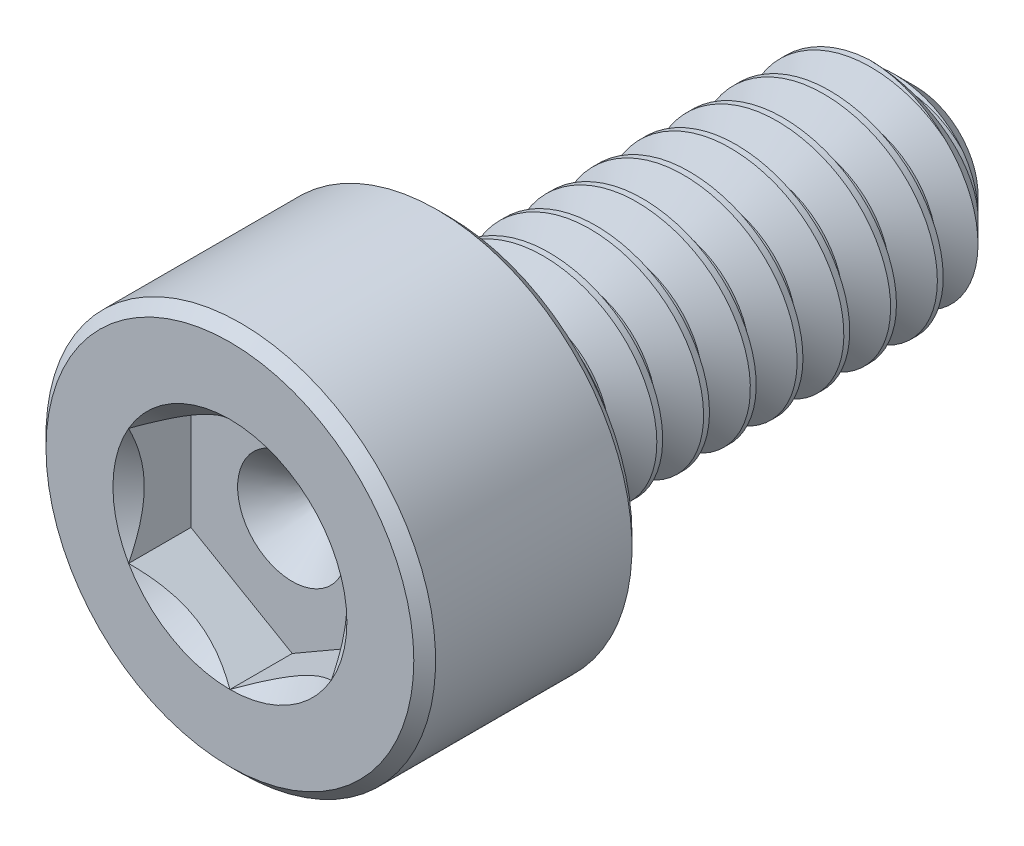
from build123d import *

# Parameters (mm, degrees)
CUT_EXTRUDE1_DEPTH = 0.4
SKETCH4_R          = 0.75055535
CUT_EXTRUDE2_DEPTH = 0.7
CUT_EXTRUDE2_DRAFT = -45
CUT_SWEEP1_PITCH   = 0.3


# Read off the part's stored shape, not the designer's step: Split1
with BuildPart() as part:
    # Sketch2 → Revolve1 (revolve)
    with BuildSketch(Plane(origin=(0, 0, 0), x_dir=(0, 0, -1), z_dir=(1, 0, 0))):
        Polygon((-2.2, 0), (-2.2, 1.18), (-2.13, 1.25), (-0.87, 1.25), (-0.8, 1.18), (-0.8, 0.7), (1.9, 0.7), (2.2, 0.4), (2.2, 0), align=None)
    revolve(axis=Axis((0, 0, -2.2), (0, 0, 1)))

    # Sketch3 → Cut-Extrude1 (cut)
    with BuildSketch(Plane.XY.offset(2.2)):
        Polygon((0.65, -0.375277675), (0.65, 0.375277675), (0, 0.75055535), (-0.65, 0.375277675), (-0.65, -0.375277675), (0, -0.75055535), align=None)
    extrude(amount=-CUT_EXTRUDE1_DEPTH, mode=Mode.SUBTRACT)


with BuildPart() as cut_extrude2_tool:
    # Sketch4 → Cut-Extrude2 (with draft: the straight prism first)
    with BuildSketch(Plane.XY.offset(2.2)):
        Circle(SKETCH4_R)
    extrude(amount=-CUT_EXTRUDE2_DEPTH)
    # Cut-Extrude2: the draft: its side faces are tilted about the plane it starts from
    cut_extrude2_sides = [cut_extrude2_tool.faces().sort_by_distance(p)[0] for p in [
        (-0.75055535, 0, 1.85),
    ]]
    draft(cut_extrude2_sides, Plane.XY.offset(2.2), CUT_EXTRUDE2_DRAFT)


with BuildPart() as part_1:
    add(part.part)

    # Cut-Extrude2: cut by cut_extrude2_tool
    add(cut_extrude2_tool.part, mode=Mode.SUBTRACT)


with BuildPart() as body_2:
    # Split1: the piece on the far side of the plane
    add(part_1.part)
    split(bisect_by=Plane.XY.offset(0.8), keep=Keep.BOTTOM)

    # Cut-Sweep1: the profile of Sketch7 screwed along a right-hand helix of 11.15 turns, 6 arcs to a turn; built about Z, then put on its axis
    cut_sweep1_z = Axis((0, 0, 0), (0, 0, 1))
    cut_sweep1_corners = [(0.716237976, 0, 0.009375), (0.716237976, 0, -0.271875), (0.505144284, 0, -0.15), (0.505144284, 0, -0.1125)]
    with BuildLine(mode=Mode.PRIVATE) as cut_sweep1_profile:
        Line(cut_sweep1_corners[0], cut_sweep1_corners[1])
        Line(cut_sweep1_corners[1], cut_sweep1_corners[2])
        Line(cut_sweep1_corners[2], cut_sweep1_corners[3])
        Line(cut_sweep1_corners[3], cut_sweep1_corners[0])
    cut_sweep1_cap = Face(cut_sweep1_profile.wire())
    cut_sweep1_turn_angles = [0, 30, 60, 90, 120, 150, 180, 210, 240, 270, 300, 330, 360]
    cut_sweep1_turn_weights = [1, 0.8660254037844387, 1, 0.8660254037844387, 1, 0.8660254037844387, 1, 0.8660254037844387, 1, 0.8660254037844387, 1, 0.8660254037844387, 1]
    cut_sweep1_turn_rails = [Edge.make_bspline([Vector(p[0], p[1], 0).rotate(cut_sweep1_z, cut_sweep1_turn_angles[k]) / cut_sweep1_turn_weights[k] + Vector(0, 0, p[2] + CUT_SWEEP1_PITCH * cut_sweep1_turn_angles[k] / 360) for k in range(13)], [0, 0, 0, 1, 1, 2, 2, 3, 3, 4, 4, 5, 5, 6, 6, 6], 2, cut_sweep1_turn_weights) for p in cut_sweep1_corners]
    cut_sweep1_turn_sides = [Face.make_surface_from_curves(cut_sweep1_turn_rails[p[0]], cut_sweep1_turn_rails[p[1]]) for p in [(0, 1), (1, 2), (2, 3), (3, 0)]]
    cut_sweep1_last_angles = [3960, 3987, 4014]
    cut_sweep1_last_weights = [1, 0.8910065241884219, 1]
    cut_sweep1_last_rails = [Edge.make_bspline([Vector(p[0], p[1], 0).rotate(cut_sweep1_z, cut_sweep1_last_angles[k]) / cut_sweep1_last_weights[k] + Vector(0, 0, p[2] + CUT_SWEEP1_PITCH * cut_sweep1_last_angles[k] / 360) for k in range(3)], [0, 0, 0, 1, 1, 1], 2, cut_sweep1_last_weights) for p in cut_sweep1_corners]
    cut_sweep1_last_sides = [Face.make_surface_from_curves(cut_sweep1_last_rails[p[0]], cut_sweep1_last_rails[p[1]]) for p in [(0, 1), (1, 2), (2, 3), (3, 0)]]
    cut_sweep1 = Plane(origin=(0, 0, -2.2), x_dir=(0, 1, 0), z_dir=(0, 0, 1)) * Solid(Shell([*[p.moved(Location((0, 0, CUT_SWEEP1_PITCH * i))) for i in range(11) for p in cut_sweep1_turn_sides], *cut_sweep1_last_sides, cut_sweep1_cap, cut_sweep1_cap.rotate(cut_sweep1_z, 4014).moved(Location((0, 0, CUT_SWEEP1_PITCH * 4014 / 360)))]))
    add(cut_sweep1, mode=Mode.SUBTRACT)


with BuildPart() as part_2:
    add(part_1.part)

    # Split1
    split(bisect_by=Plane.XY.offset(0.8), keep=Keep.TOP)

    add(body_2.part)  # Boss-Extrude1 merges body 2
    # Boss-Extrude1 cone 1 section (through the dimple's axis) → Boss-Extrude1 (revolve)
    with BuildSketch(Plane(origin=(0, 0, 0.8), x_dir=(0, -1, 0), z_dir=(1, 0, 0))):
        Polygon((0, 0), (0.7, 0), (0, 0.7), align=None)
    revolve(axis=Axis((0, 0, 0.8), (0, 0, -1)))


solid = part_2.part
